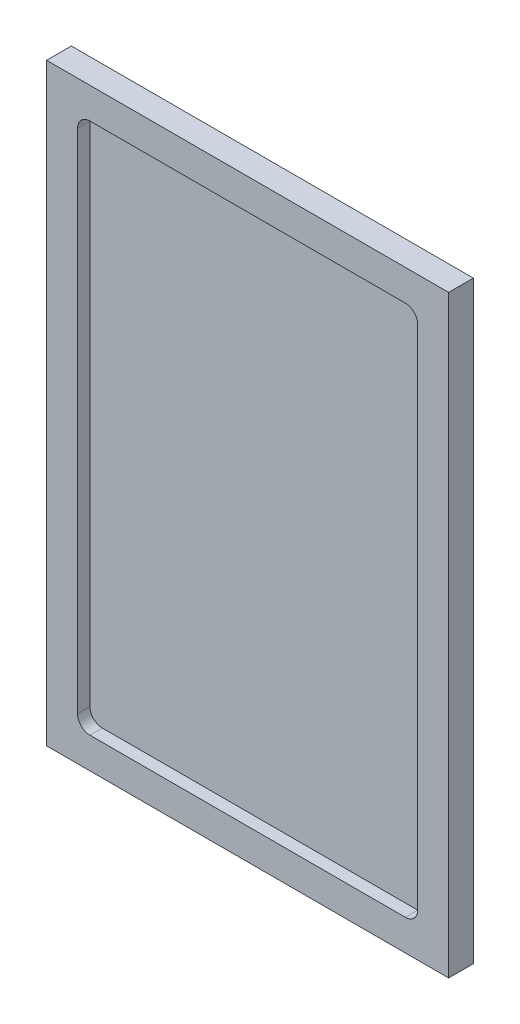
from build123d import *

# Parameters (mm, degrees)
SKETCH1_W           = 206.375
SKETCH1_H           = 304.8
BOSS_EXTRUDE1_DEPTH = 12.7
CUT_EXTRUDE1_DEPTH  = 6.35


with BuildPart() as part:
    # Sketch1 → Boss-Extrude1 (new body)
    with BuildSketch(Plane.XY):
        Rectangle(SKETCH1_W, SKETCH1_H)
    extrude(amount=BOSS_EXTRUDE1_DEPTH)

    # Sketch2 → Cut-Extrude1 (cut)
    with BuildSketch(Plane.XY.offset(12.7)):
        with BuildLine():
            Line((80.9625, -136.525), (-80.9625, -136.525))
            ThreePointArc((-80.9625, -136.525), (-85.452628061, -134.665128061), (-87.3125, -130.175))
            Line((-87.3125, -130.175), (-87.3125, 130.175))
            ThreePointArc((-87.3125, 130.175), (-85.452628061, 134.665128061), (-80.9625, 136.525))
            Line((-80.9625, 136.525), (80.9625, 136.525))
            ThreePointArc((80.9625, 136.525), (85.452628061, 134.665128061), (87.3125, 130.175))
            Line((87.3125, 130.175), (87.3125, -130.175))
            ThreePointArc((87.3125, -130.175), (85.452628061, -134.665128061), (80.9625, -136.525))
        make_face()
    extrude(amount=-CUT_EXTRUDE1_DEPTH, mode=Mode.SUBTRACT)


solid = part.part
